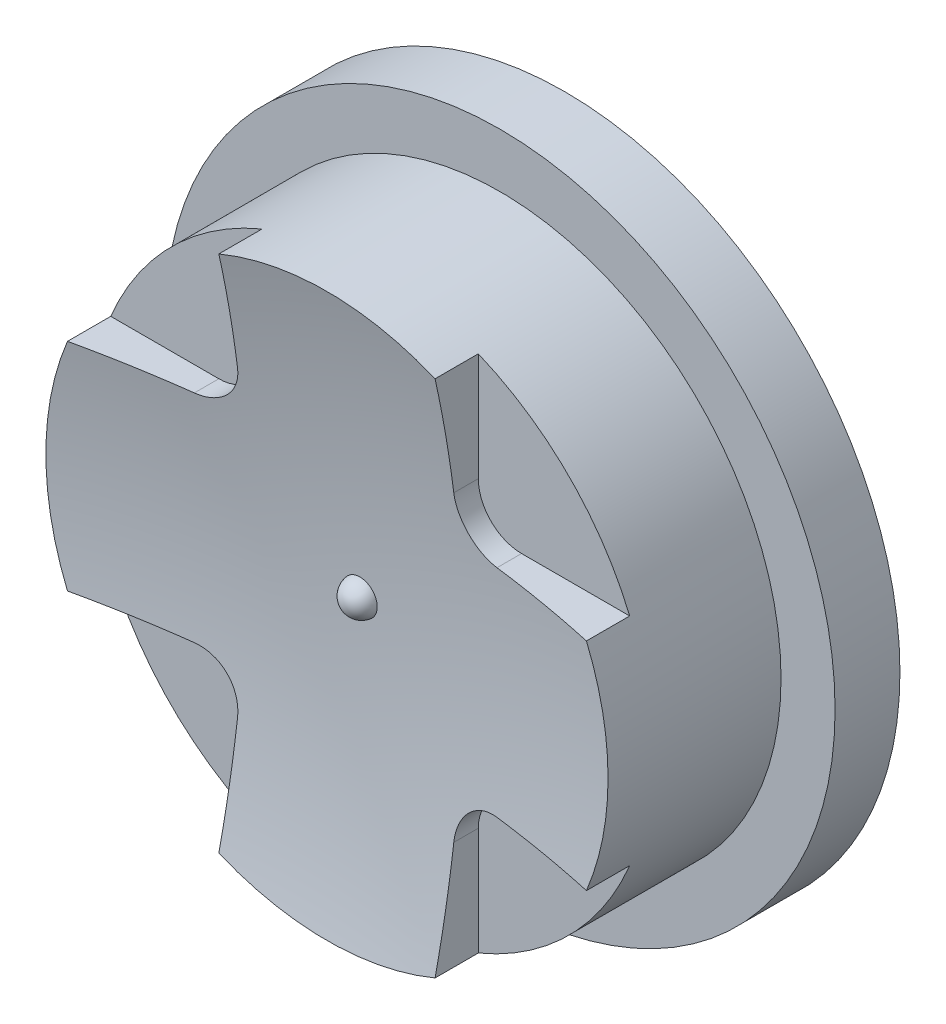
from build123d import *
from build123d.topology import SkipClean

# Parameters (mm, degrees)
SKETCH_1_R          = 7.75
EXTRUDE_1_DEPTH     = 1.5
SKETCH_2_R          = 6.5
EXTRUDE_2_DEPTH     = 4
SKETCH_4_W          = 19
SKETCH_4_H          = 19
CUT_EXTRUDE_1_DEPTH = 1
SKETCH_5_R          = 0.4
EXTRUDE_3_DEPTH     = 5.1
FILLET_1_R          = 0.4
FILLET_2_R          = 1


with BuildPart() as part:
    # 草图1 → 凸台-拉伸1 (new body)
    with BuildSketch(Plane.XY):
        Circle(SKETCH_1_R)
    extrude(amount=EXTRUDE_1_DEPTH)

    # 草图2 → 凸台-拉伸2 (add)
    with BuildSketch(Plane.XY.offset(1.5)):
        Circle(SKETCH_2_R)
    extrude(amount=EXTRUDE_2_DEPTH)

    # 草图4 → 切除-拉伸1 (cut)
    with BuildSketch(Plane.XY.offset(5.5)):
        Rectangle(SKETCH_4_W, SKETCH_4_H)
        Polygon((-2.5, 7.5), (-2.5, 2.5), (-7.5, 2.5), (-7.5, -2.5), (-2.5, -2.5), (-2.5, -7.5), (2.5, -7.5), (2.5, -2.5), (7.5, -2.5), (7.5, 2.5), (2.5, 2.5), (2.5, 7.5), align=None, mode=Mode.SUBTRACT)
    extrude(amount=-CUT_EXTRUDE_1_DEPTH, mode=Mode.SUBTRACT)

    # 草图3 → 切除-旋转2 (revolve, cut)
    with SkipClean():  # the faces are left unmerged after this step: merging them gives an invalid solid
        with BuildSketch(Plane(origin=(0, 0, 0), x_dir=(1, 0, 0), z_dir=(0, 1, 0)), mode=Mode.PRIVATE) as cut_revolve_2_sk:
            with BuildLine():
                Line((-6.5, -5.5), (0, -5.5))
                Line((0, -5.5), (0, -4.735087663))
                ThreePointArc((0, -4.735087663), (-3.272426122, -4.926973248), (-6.5, -5.5))
            make_face()
            with BuildLine():
                Line((0, -4.735087663), (0, -5.5))
                Line((0, -5.5), (6.5, -5.5))
                ThreePointArc((6.5, -5.5), (3.272426122, -4.926973248), (0, -4.735087663))
            make_face()
        revolve(cut_revolve_2_sk.sketch.rotate(Axis((0, 0, 1000), (0, 0, -1)), 337.380135052), axis=Axis((0, 0, 1000), (0, 0, -1)), mode=Mode.SUBTRACT)
    add(part.part.scale(1), mode=Mode.REPLACE)  # the faces are merged on a copy

    # 草图5 → 凸台-拉伸3 (add)
    with BuildSketch(Plane(origin=(0, 0, 0), x_dir=(-1, 0, 0), z_dir=(0, 0, -1))):
        Circle(SKETCH_5_R)
    extrude(amount=-EXTRUDE_3_DEPTH)

    # 圆角1
    # the kernel refuses this fillet: 0.4 mm, written as the material it takes off along each edge
    with BuildSketch(Plane(origin=(0, 0, 5.1), x_dir=(-1, 0, 0), z_dir=(0, -1, 0))) as fillet_1_piece_1:
        with BuildLine():
            CenterArc((0.001803842, 0.4), FILLET_1_R, 270, 84.556601085)
            Line((0.001803842, 0), (0.001803842, -0.008))
            Line((0.001803842, -0.008), (0.4, -0.008))
            Line((0.4, -0.008), (0.408, 0))
            ThreePointArc((0.408, 0), (0.408, 0.181027524), (0.407963923, 0.36129615))
            Line((0.407963923, 0.36129615), (0.4, 0.362055049))
        make_face()
    revolve(axis=Axis((0, 0, 5.1), (0, 0, -1)), mode=Mode.SUBTRACT)

    # 圆角2
    fillet_2_edges = [part.edges().sort_by_distance(p)[0] for p in [
        (2.5, 2.5, 4.729599419),
        (2.5, -2.5, 4.729599419),
        (-2.5, -2.5, 4.729599419),
        (-2.5, 2.5, 4.729599419),
    ]]
    fillet(fillet_2_edges, radius=FILLET_2_R)


solid = part.part
